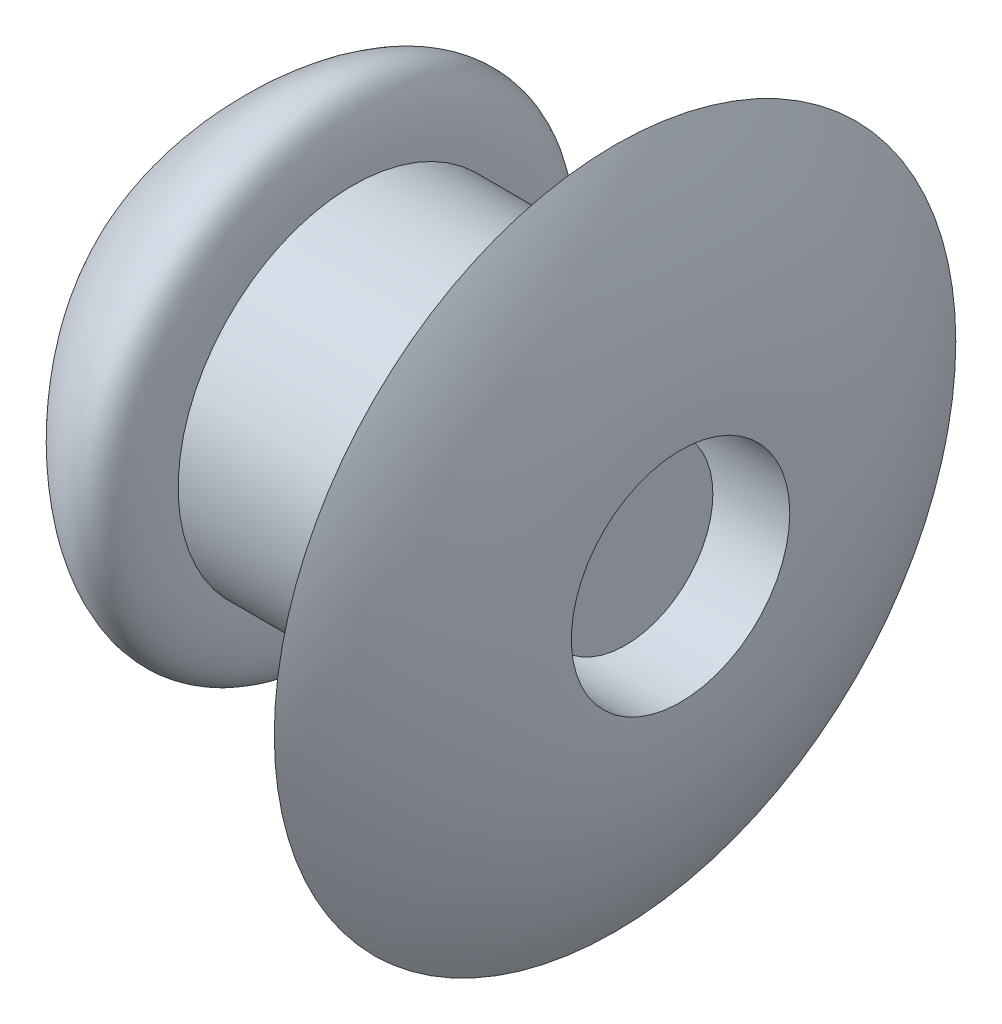
from build123d import *


with BuildPart() as part:
    # Szkic1 → Obrót1 (revolve)
    with BuildSketch(Plane.XY):
        with BuildLine():
            Line((350.856147885, 893.681551629), (346.181077863, 893.681551629))
            add(Edge.make_bspline(
                [(346.791980649, 894.856511413), (345.908957287, 894.874577993), (346.181077863, 893.681551629)],
                knots=[0, 0, 0, 1, 1, 1], degree=2))
            add(Edge.make_bspline(
                [(347.7366, 895.681551629), (347.773155425, 898.021351683), (344.273194653, 893.309377005), (346.495284652, 895.170148194), (346.791980649, 894.856511413)],
                knots=[0, 0, 0, 0, 0.744501965, 1, 1, 1, 1], degree=3))
            Line((347.7366, 895.681551629), (350.7366, 895.681551629))
            Line((350.7366, 895.681551629), (350.7366, 897.581551629))
            ThreePointArc((350.7366, 897.581551629), (351.295488572, 896.308595565), (351.4866, 894.931551629))
            Line((351.4866, 894.931551629), (347.7366, 894.931551629))
            Line((347.7366, 894.931551629), (347.7366, 894.681551629))
            Line((347.7366, 894.681551629), (350.856147885, 894.681551629))
            Line((350.856147885, 894.681551629), (350.856147885, 893.681551629))
        make_face()
    revolve(axis=Axis((350.856147885, 893.681551629, 0), (-1, 0, 0)))


solid = part.part
